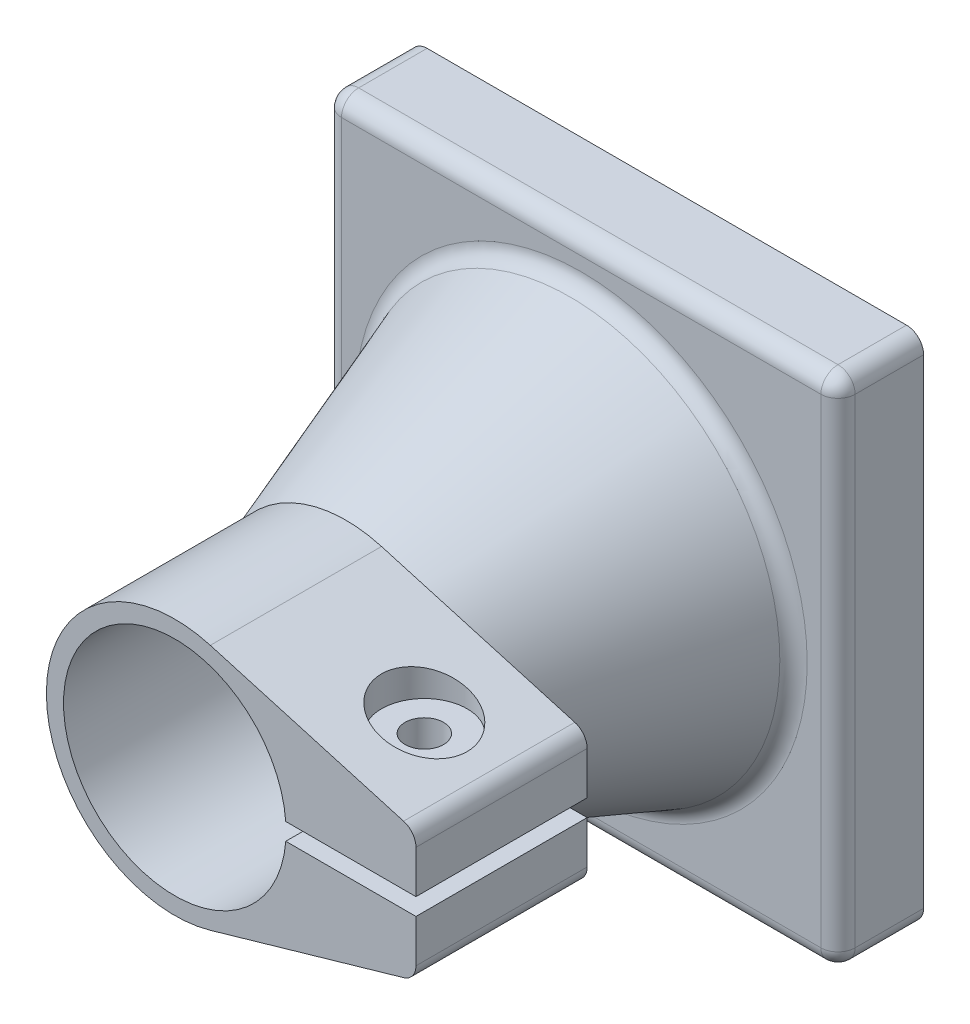
from build123d import *

# Parameters (mm, degrees)
SKETCH1_W           = 60
SKETCH1_H           = 60
BOSS_EXTRUDE1_DEPTH = 10
FILLET1_R           = 2
FILLET2_R           = 2
SKETCH3_R           = 15
SKETCH3_R_2         = 13
BOSS_EXTRUDE2_DEPTH = 20
CUT_EXTRUDE1_START  = -20
SKETCH4_R           = 13
CUT_EXTRUDE1_DEPTH  = 20
BOSS_EXTRUDE4_START = -20
BOSS_EXTRUDE4_DEPTH = 20
FILLET5_R           = 2
CUT_EXTRUDE2_REACH  = 83.874
SKETCH12_R          = 2.25
SKETCH13_R          = 5
CUT_EXTRUDE3_DEPTH  = 12
CUT_EXTRUDE4_START  = 12
SKETCH14_R          = 5
CUT_EXTRUDE4_DEPTH  = 12
CUT_EXTRUDE12_START = -20
CUT_EXTRUDE12_DEPTH = 20


with BuildPart() as part:
    # Sketch1 → Boss-Extrude1 (new body)
    with BuildSketch(Plane.XY):
        Rectangle(SKETCH1_W, SKETCH1_H)
    extrude(amount=BOSS_EXTRUDE1_DEPTH)

    # Sketch2 → Revolve1 (revolve)
    with BuildSketch(Plane(origin=(0, 0, 0), x_dir=(1, 0, 0), z_dir=(0, 1, 0)), mode=Mode.PRIVATE) as revolve1_sk:
        Polygon((-25, -10), (-15, -37.474774195), (0, -37.474774195), (0, -10), align=None)
    revolve(revolve1_sk.sketch.rotate(Axis((0, 0, 38.640996606), (0, 0, -1)), 180), axis=Axis((0, 0, 38.640996606), (0, 0, -1)))

    # Fillet1
    fillet1_edges = [part.edges().sort_by_distance(p)[0] for p in [
        (30, 0, 10),
        (0, 30, 10),
        (-25, 0, 10),
        (-30, 0, 10),
        (0, -30, 10),
    ]]
    fillet(fillet1_edges, radius=FILLET1_R)

    # Fillet2
    # the kernel refuses this fillet: 2 mm, written as the material it takes off along each edge
    with BuildSketch(Plane(origin=(28, -28, 8), x_dir=(0, -1, 0), z_dir=(1, 0, 0))) as fillet2_piece_1_section:
        Polygon((0, 0), (FILLET2_R, 0), (FILLET2_R, -FILLET2_R), (0, -FILLET2_R), align=None)
    fillet2_piece_1 = extrude(amount=FILLET2_R, mode=Mode.PRIVATE)
    fillet2_piece_1 = fillet2_piece_1 - Plane(origin=(28, -28, 8), x_dir=(0, 0.7071067811865475, -0.7071067811865475), z_dir=(1, 0, 0)) * Sphere(FILLET2_R, mode=Mode.PRIVATE)
    add(fillet2_piece_1, mode=Mode.SUBTRACT)
    with BuildSketch(Plane(origin=(-28, -28, 8), x_dir=(0, -1, 0), z_dir=(-1, 0, 0))) as fillet2_piece_2_section:
        Polygon((0, 0), (FILLET2_R, 0), (FILLET2_R, FILLET2_R), (0, FILLET2_R), align=None)
    fillet2_piece_2 = extrude(amount=FILLET2_R, mode=Mode.PRIVATE)
    fillet2_piece_2 = fillet2_piece_2 - Plane(origin=(-28, -28, 8), x_dir=(0, 0.7071067811865475, -0.7071067811865475), z_dir=(-1, 0, 0)) * Sphere(FILLET2_R, mode=Mode.PRIVATE)
    add(fillet2_piece_2, mode=Mode.SUBTRACT)
    with BuildSketch(Plane(origin=(28, 28, 8), x_dir=(1, 0, 0), z_dir=(0, 1, 0))) as fillet2_piece_3_section:
        Polygon((0, 0), (FILLET2_R, 0), (FILLET2_R, -FILLET2_R), (0, -FILLET2_R), align=None)
    fillet2_piece_3 = extrude(amount=FILLET2_R, mode=Mode.PRIVATE)
    fillet2_piece_3 = fillet2_piece_3 - Plane(origin=(28, 28, 8), x_dir=(-0.7071067811865475, 0, -0.7071067811865475), z_dir=(0, 1, 0)) * Sphere(FILLET2_R, mode=Mode.PRIVATE)
    add(fillet2_piece_3, mode=Mode.SUBTRACT)
    with BuildSketch(Plane(origin=(-28, 28, 8), x_dir=(-1, 0, 0), z_dir=(0, 1, 0))) as fillet2_piece_4_section:
        Polygon((0, 0), (FILLET2_R, 0), (FILLET2_R, FILLET2_R), (0, FILLET2_R), align=None)
    fillet2_piece_4 = extrude(amount=FILLET2_R, mode=Mode.PRIVATE)
    fillet2_piece_4 = fillet2_piece_4 - Plane(origin=(-28, 28, 8), x_dir=(0.7071067811865475, 0, -0.7071067811865475), z_dir=(0, 1, 0)) * Sphere(FILLET2_R, mode=Mode.PRIVATE)
    add(fillet2_piece_4, mode=Mode.SUBTRACT)
    with BuildSketch(Plane(origin=(-30, 30, -5), x_dir=(1, 0, 0), z_dir=(0, 0, 1)), Plane(origin=(-30, -30, -5), x_dir=(0, 1, 0), z_dir=(0, 0, 1))) as fillet2_piece_5:
        with BuildLine():
            CenterArc((FILLET2_R, -FILLET2_R), FILLET2_R, 90, 90)
            Line((0, -FILLET2_R), (0, 0))
            Line((0, 0), (FILLET2_R, 0))
        make_face()
    extrude(amount=13, mode=Mode.SUBTRACT)
    with BuildSketch(Plane(origin=(30, 30, -5), x_dir=(-1, 0, 0), z_dir=(0, 0, 1)), Plane(origin=(30, -30, -5), x_dir=(0, 1, 0), z_dir=(0, 0, 1))) as fillet2_piece_6:
        with BuildLine():
            CenterArc((FILLET2_R, FILLET2_R), FILLET2_R, 180, 90)
            Line((0, FILLET2_R), (0, 0))
            Line((0, 0), (FILLET2_R, 0))
        make_face()
    extrude(amount=13, mode=Mode.SUBTRACT)

    # Sketch3 → Boss-Extrude2 (add)
    with BuildSketch(Plane.XY.offset(37.474774195)):
        Circle(SKETCH3_R)
        Circle(SKETCH3_R_2, mode=Mode.SUBTRACT)
    extrude(amount=BOSS_EXTRUDE2_DEPTH)

    # Sketch4 → Cut-Extrude1 (cut)
    with BuildSketch(Plane.XY.offset(37.474774195).offset(CUT_EXTRUDE1_START)):
        Circle(SKETCH4_R)
    extrude(amount=CUT_EXTRUDE1_DEPTH, mode=Mode.SUBTRACT)

    # Sketch7 → Boss-Extrude4 (add)
    with BuildSketch(Plane.XY.offset(57.474774195).offset(BOSS_EXTRUDE4_START)):
        with BuildLine():
            Line((4.148885958, 14.41480993), (28.173569174, 7.5))
            Line((28.173569174, 7.5), (28.173569174, -7.5))
            Line((28.173569174, -7.5), (4.148885958, -14.41480993))
            ThreePointArc((4.148885958, -14.41480993), (15, 0), (4.148885958, 14.41480993))
        make_face()
    extrude(amount=BOSS_EXTRUDE4_DEPTH)

    # Fillet5
    fillet5_edges = [part.edges().sort_by_distance(p)[0] for p in [
        (28.173569174, 7.5, 47.474774195),
        (28.173569174, -7.5, 47.474774195),
    ]]
    fillet(fillet5_edges, radius=FILLET5_R)

    # Cut-Extrude2: up to this plane
    cut_extrude2_end = Plane(origin=(4.148885958, -14.41480993, 37.474774195), z_dir=(0.27659239718755785, -0.9609873286459298, 0))
    # Sketch12 → Cut-Extrude2 (cut, up to the surface)
    with BuildSketch(Plane(origin=(0, 20, 0), x_dir=(1, 0, 0), z_dir=(0, 1, 0)), mode=Mode.PRIVATE) as cut_extrude2_sk1:
        with Locations(Location((19.148885958, -47.474774195, 0), (0, 0, 180))):
            Circle(SKETCH12_R)
    cut_extrude2_tool1 = split(extrude(cut_extrude2_sk1.sketch, amount=-CUT_EXTRUDE2_REACH, mode=Mode.PRIVATE), bisect_by=cut_extrude2_end, keep=Keep.BOTH, mode=Mode.PRIVATE)
    add(cut_extrude2_tool1.solids().sort_by_distance((19.148886, 20, 47.474774))[0], mode=Mode.SUBTRACT)

    # Sketch13 → Cut-Extrude3 (cut)
    with BuildSketch(Plane(origin=(0, 20, 0), x_dir=(1, 0, 0), z_dir=(0, 1, 0))):
        with Locations(Location((19.148885958, -47.474774195, 0), (0, 0, 270))):
            Circle(SKETCH13_R)
    extrude(amount=-CUT_EXTRUDE3_DEPTH, mode=Mode.SUBTRACT)

    # Sketch14 → Cut-Extrude4 (cut)
    with BuildSketch(Plane(origin=(0, -20, 0), x_dir=(1, 0, 0), z_dir=(0, 1, 0)).offset(CUT_EXTRUDE4_START)):
        with Locations(Location((19.148885958, -47.474774195, 0), (0, 0, 270))):
            Circle(SKETCH14_R)
    extrude(amount=-CUT_EXTRUDE4_DEPTH, mode=Mode.SUBTRACT)

    # Sketch15 → Cut-Extrude12 (cut)
    with BuildSketch(Plane.XY.offset(57.474774195).offset(CUT_EXTRUDE12_START)):
        with BuildLine():
            Line((28.173569174, 1), (12.961481397, 1))
            ThreePointArc((12.961481397, 1), (13, 0), (12.961481397, -1))
            Line((12.961481397, -1), (28.173569174, -1))
            Line((28.173569174, -1), (28.173569174, 1))
        make_face()
    extrude(amount=CUT_EXTRUDE12_DEPTH, mode=Mode.SUBTRACT)


solid = part.part
